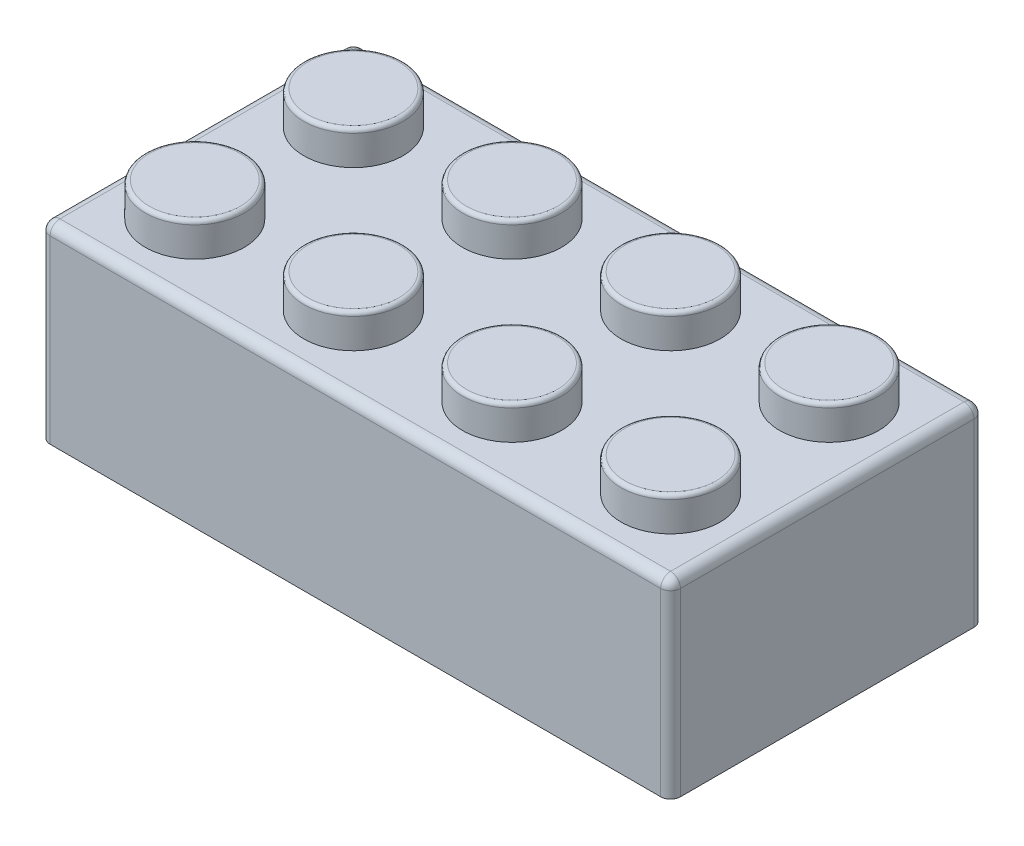
from build123d import *

# Parameters (mm, degrees)
SKETCH2_W              = 31.8
SKETCH2_H              = 15.8
BOSS_EXTRUDE1_DEPTH    = 9.6
FILLET1_R              = 0.5
FILLET3_R              = 0.5
SKETCH4_W              = 28.82
SKETCH4_H              = 12.82
CUT_EXTRUDE1_DEPTH     = 8.1
SKETCH6_R              = 2.5
BOSS_EXTRUDE3_DEPTH    = 1.7
FILLET2_R              = 0.2
LPATTERN3_COUNT        = 4
LPATTERN3_PITCH        = 8
LPATTERN3_COUNT_DIR2   = 2
LPATTERN3_PITCH_DIR2   = 8
FILLET2_OF_LPATTERN3_R = 0.2
SKETCH8_R              = 3.155
BOSS_EXTRUDE4_DEPTH    = 8.1
SKETCH9_R              = 2.655
CUT_EXTRUDE2_DEPTH     = 8.1
LPATTERN4_COUNT        = 3
LPATTERN4_PITCH        = 8


with BuildPart() as part:
    # Sketch2 → Boss-Extrude1 (new body)
    with BuildSketch(Plane(origin=(0, 0, 0), x_dir=(1, 0, 0), z_dir=(0, 1, 0))):
        with Locations((0.57083662, 0.816459546)):
            Rectangle(SKETCH2_W, SKETCH2_H)
    extrude(amount=BOSS_EXTRUDE1_DEPTH)

    # Fillet1
    fillet1_edges = [part.edges().sort_by_distance(p)[0] for p in [
        (0.57083662, 9.6, -8.716459546),
        (-15.32916338, 9.6, -0.816459546),
        (0.57083662, 9.6, 7.083540454),
        (16.47083662, 9.6, -0.816459546),
    ]]
    fillet(fillet1_edges, radius=FILLET1_R)

    # Fillet3
    # the kernel refuses this fillet: 0.5 mm, written as the material it takes off along each edge
    with BuildSketch(Plane(origin=(-14.82916338, 9.1, -8.216459546), x_dir=(-1, 0, 0), z_dir=(0, 0, -1))) as fillet3_piece_1_section:
        Polygon((0, 0), (FILLET3_R, 0), (FILLET3_R, FILLET3_R), (0, FILLET3_R), align=None)
    fillet3_piece_1 = extrude(amount=FILLET3_R, mode=Mode.PRIVATE)
    fillet3_piece_1 = fillet3_piece_1 - Plane(origin=(-14.82916338, 9.1, -8.216459546), x_dir=(0.7071067811865475, -0.7071067811865475, 0), z_dir=(0, 0, -1)) * Sphere(FILLET3_R, mode=Mode.PRIVATE)
    add(fillet3_piece_1, mode=Mode.SUBTRACT)
    with BuildSketch(Plane(origin=(-14.82916338, 9.1, 6.583540454), x_dir=(0, 0, 1), z_dir=(-1, 0, 0))) as fillet3_piece_2_section:
        Polygon((0, 0), (FILLET3_R, 0), (FILLET3_R, FILLET3_R), (0, FILLET3_R), align=None)
    fillet3_piece_2 = extrude(amount=FILLET3_R, mode=Mode.PRIVATE)
    fillet3_piece_2 = fillet3_piece_2 - Plane(origin=(-14.82916338, 9.1, 6.583540454), x_dir=(0, -0.7071067811865475, -0.7071067811865475), z_dir=(-1, 0, 0)) * Sphere(FILLET3_R, mode=Mode.PRIVATE)
    add(fillet3_piece_2, mode=Mode.SUBTRACT)
    with BuildSketch(Plane(origin=(15.97083662, 9.1, -8.216459546), x_dir=(1, 0, 0), z_dir=(0, 0, -1))) as fillet3_piece_3_section:
        Polygon((0, 0), (FILLET3_R, 0), (FILLET3_R, -FILLET3_R), (0, -FILLET3_R), align=None)
    fillet3_piece_3 = extrude(amount=FILLET3_R, mode=Mode.PRIVATE)
    fillet3_piece_3 = fillet3_piece_3 - Plane(origin=(15.97083662, 9.1, -8.216459546), x_dir=(-0.7071067811865475, -0.7071067811865475, 0), z_dir=(0, 0, -1)) * Sphere(FILLET3_R, mode=Mode.PRIVATE)
    add(fillet3_piece_3, mode=Mode.SUBTRACT)
    with BuildSketch(Plane(origin=(15.97083662, 9.1, 6.583540454), x_dir=(0, 0, 1), z_dir=(1, 0, 0))) as fillet3_piece_4_section:
        Polygon((0, 0), (FILLET3_R, 0), (FILLET3_R, -FILLET3_R), (0, -FILLET3_R), align=None)
    fillet3_piece_4 = extrude(amount=FILLET3_R, mode=Mode.PRIVATE)
    fillet3_piece_4 = fillet3_piece_4 - Plane(origin=(15.97083662, 9.1, 6.583540454), x_dir=(0, -0.7071067811865475, -0.7071067811865475), z_dir=(1, 0, 0)) * Sphere(FILLET3_R, mode=Mode.PRIVATE)
    add(fillet3_piece_4, mode=Mode.SUBTRACT)
    with BuildSketch(Plane(origin=(16.47083662, -1.25, -8.716459546), x_dir=(-1, 0, 0), z_dir=(0, 1, 0)), Plane(origin=(16.47083662, -1.25, 7.083540454), x_dir=(0, 0, -1), z_dir=(0, 1, 0))) as fillet3_piece_5:
        with BuildLine():
            CenterArc((FILLET3_R, FILLET3_R), FILLET3_R, 180, 90)
            Line((0, FILLET3_R), (0, 0))
            Line((0, 0), (FILLET3_R, 0))
        make_face()
    extrude(amount=10.35, mode=Mode.SUBTRACT)
    with BuildSketch(Plane(origin=(-15.32916338, -1.25, 7.083540454), x_dir=(0, 0, -1), z_dir=(0, 1, 0)), Plane(origin=(-15.32916338, -1.25, -8.716459546), x_dir=(1, 0, 0), z_dir=(0, 1, 0))) as fillet3_piece_6:
        with BuildLine():
            CenterArc((FILLET3_R, -FILLET3_R), FILLET3_R, 90, 90)
            Line((0, -FILLET3_R), (0, 0))
            Line((0, 0), (FILLET3_R, 0))
        make_face()
    extrude(amount=10.35, mode=Mode.SUBTRACT)

    # Sketch4 → Cut-Extrude1 (cut)
    with BuildSketch(Plane.XZ):
        with Locations((0.57083662, -0.816459546)):
            Rectangle(SKETCH4_W, SKETCH4_H)
    extrude(amount=-CUT_EXTRUDE1_DEPTH, mode=Mode.SUBTRACT)

    # Sketch6 → Boss-Extrude3 (add)
    with BuildSketch(Plane(origin=(0, 9.6, 0), x_dir=(1, 0, 0), z_dir=(0, 1, 0))):
        with Locations(Location((-11.42916338, 4.816459546, 0), (0, 0, 90))):
            Circle(SKETCH6_R)
    boss_extrude3 = extrude(amount=BOSS_EXTRUDE3_DEPTH)

    # Fillet2
    fillet2_edges = [part.edges().sort_by_distance(p)[0] for p in [
        (-11.42916338, 11.3, -2.316459546),
    ]]
    fillet(fillet2_edges, radius=FILLET2_R)

    # LPattern3: Boss-Extrude3 4 × 2
    with Locations(*[(i * LPATTERN3_PITCH, 0, j * LPATTERN3_PITCH_DIR2) for i in range(LPATTERN3_COUNT) for j in range(LPATTERN3_COUNT_DIR2) if (i, j) != (0, 0)]):
        add(boss_extrude3)

    # Fillet2 of LPattern3
    fillet2_of_lpattern3_edges = [part.edges().sort_by_distance(p)[0] for p in [
        (-11.42916338, 11.3, 5.683540454),
        (-3.42916338, 11.3, -2.316459546),
        (-3.42916338, 11.3, 5.683540454),
        (4.57083662, 11.3, -2.316459546),
        (4.57083662, 11.3, 5.683540454),
        (12.57083662, 11.3, -2.316459546),
        (12.57083662, 11.3, 5.683540454),
    ]]
    fillet(fillet2_of_lpattern3_edges, radius=FILLET2_OF_LPATTERN3_R)

    # Sketch8 → Boss-Extrude4 (add)
    with BuildSketch(Plane.XZ.offset(-8.1)):
        with Locations(Location((8.57083662, -0.816459546, 0), (0, 0, 270))):
            Circle(SKETCH8_R)
    boss_extrude4 = extrude(amount=BOSS_EXTRUDE4_DEPTH)

    # Sketch9 → Cut-Extrude2 (cut)
    with BuildSketch(Plane.XZ):
        with Locations(Location((8.57083662, -0.816459546, 0), (0, 0, 270))):
            Circle(SKETCH9_R)
    cut_extrude2 = extrude(amount=-CUT_EXTRUDE2_DEPTH, mode=Mode.SUBTRACT)

    # LPattern4: Boss-Extrude4, Cut-Extrude2 ×3
    with Locations(*[(-i * LPATTERN4_PITCH, 0, 0) for i in range(1, LPATTERN4_COUNT)]):
        add(boss_extrude4)
        add(cut_extrude2, mode=Mode.SUBTRACT)


solid = part.part
